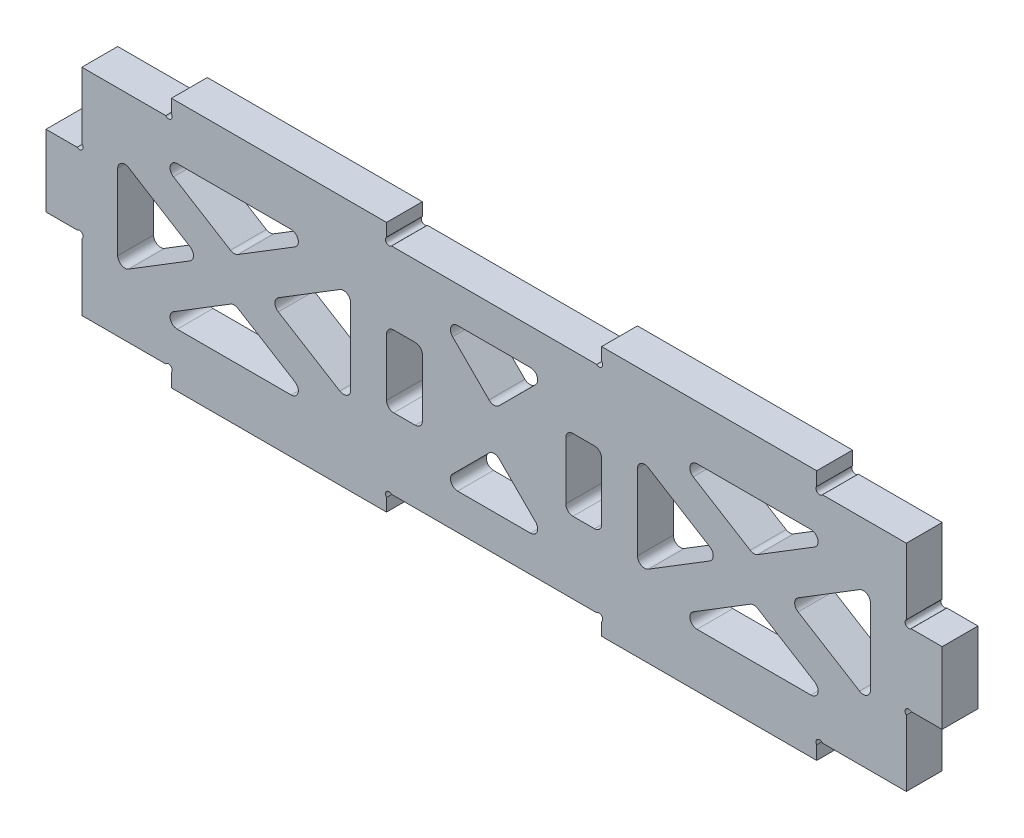
from build123d import *

# Parameters (mm, degrees)
SKETCH1_W           = 317.5
SKETCH1_H           = 76.2
BOSS_EXTRUDE1_DEPTH = 12.7
SKETCH2_W           = 76.2
SKETCH2_H           = 6.35
BOSS_EXTRUDE2_DEPTH = 12.7
SKETCH3_W           = 12.7
SKETCH3_H           = 25.4
CUT_EXTRUDE1_DEPTH  = 166.344050392
SKETCH7_R           = 1.27
CUT_EXTRUDE4_DEPTH  = 166.344050392
CUT_EXTRUDE6_DEPTH  = 166.344050392
FILLET1_R           = 2.54


with BuildPart() as part:
    # Sketch1 → Boss-Extrude1 (new body)
    with BuildSketch(Plane.XY):
        Rectangle(SKETCH1_W, SKETCH1_H)
    extrude(amount=BOSS_EXTRUDE1_DEPTH)

    # Sketch2 → Boss-Extrude2 (add)
    with BuildSketch(Plane.XY.offset(12.7)):
        with Locations((-76.2, -41.275)):
            Rectangle(SKETCH2_W, SKETCH2_H)
        with Locations((76.2, -41.275)):
            Rectangle(SKETCH2_W, SKETCH2_H)
        with Locations((76.2, 41.275)):
            Rectangle(SKETCH2_W, SKETCH2_H)
        with Locations((-76.2, 41.275)):
            Rectangle(SKETCH2_W, SKETCH2_H)
    extrude(amount=-BOSS_EXTRUDE2_DEPTH)

    # Sketch3 → Cut-Extrude1 (cut, through all)
    with BuildSketch(Plane.XY.offset(12.7)):
        with Locations((-152.4, -25.4)):
            Rectangle(SKETCH3_W, SKETCH3_H)
        with Locations((-152.4, 25.4)):
            Rectangle(SKETCH3_W, SKETCH3_H)
        with Locations((152.4, 25.4)):
            Rectangle(SKETCH3_W, SKETCH3_H)
        with Locations((152.4, -25.4)):
            Rectangle(SKETCH3_W, SKETCH3_H)
        with Locations((31.75, 0)):
            Rectangle(SKETCH3_W, SKETCH3_H)
        with Locations((-31.75, 0)):
            Rectangle(SKETCH3_W, SKETCH3_H)
    extrude(amount=-CUT_EXTRUDE1_DEPTH, mode=Mode.SUBTRACT)

    # Sketch7 → Cut-Extrude4 (cut, through all)
    with BuildSketch(Plane.XY.offset(12.7)):
        with Locations((-115.322216931, -38.853639533)):
            Circle(SKETCH7_R)
        with Locations((-37.219883345, -39.015584335)):
            Circle(SKETCH7_R)
        with Locations((37.219883345, -39.015584335)):
            Circle(SKETCH7_R)
        with Locations((115.322216931, -38.853639533)):
            Circle(SKETCH7_R)
        with Locations((115.322216931, 38.853639533)):
            Circle(SKETCH7_R)
        with Locations((37.219883345, 39.015584335)):
            Circle(SKETCH7_R)
        with Locations((-37.219883345, 39.015584335)):
            Circle(SKETCH7_R)
        with Locations((-115.322216931, 38.853639533)):
            Circle(SKETCH7_R)
        with Locations((-146.889550892, -13.652918832)):
            Circle(SKETCH7_R)
        with Locations((-146.889550892, 13.652918832)):
            Circle(SKETCH7_R)
        with Locations((146.889550892, -13.652918832)):
            Circle(SKETCH7_R)
        with Locations((146.889550892, 13.652918832)):
            Circle(SKETCH7_R)
    extrude(amount=-CUT_EXTRUDE4_DEPTH, mode=Mode.SUBTRACT)

    # Sketch4 → Cut-Extrude6 (cut, through all)
    with BuildSketch(Plane.XY.offset(12.7)):
        Polygon((-92.075, -7.45604179), (-121.233932092, -25.4), (-62.916067908, -25.4), align=None)
        Polygon((-133.35, 17.94395821), (-133.35, -17.94395821), (-104.191067908, 0), align=None)
        Polygon((-79.958932092, 0), (-50.8, -17.94395821), (-50.8, 17.94395821), align=None)
        Polygon((-62.916067908, 25.4), (-121.233932092, 25.4), (-92.075, 7.45604179), align=None)
        Polygon((19.05, 25.4), (-19.05, 25.4), (0, 6.35), align=None)
        Polygon((0, -6.35), (-19.05, -25.4), (19.05, -25.4), align=None)
    cut_extrude6 = extrude(amount=-CUT_EXTRUDE6_DEPTH, mode=Mode.SUBTRACT)

    # Mirror1: Cut-Extrude6 across plane
    add(cut_extrude6.mirror(Plane(origin=(0, 0, 0), x_dir=(0, 0, 1), z_dir=(1, 0, 0))), mode=Mode.SUBTRACT)

    # Fillet1
    fillet1_edges = [part.edges().sort_by_distance(p)[0] for p in [
        (-19.05, -25.4, 6.35),
        (-19.05, 25.4, 6.35),
        (-133.35, 17.94395821, 6.35),
        (-62.916067908, -25.4, 6.35),
        (-121.233932092, -25.4, 6.35),
        (-133.35, -17.94395821, 6.35),
        (-50.8, -17.94395821, 6.35),
        (-50.8, 17.94395821, 6.35),
        (-104.191067908, 0, 6.35),
        (-62.916067908, 25.4, 6.35),
        (-92.075, 7.45604179, 6.35),
        (-92.075, -7.45604179, 6.35),
        (-79.958932092, 0, 6.35),
        (-121.233932092, 25.4, 6.35),
        (62.916067908, 25.4, 6.35),
        (121.233932092, 25.4, 6.35),
        (133.35, 17.94395821, 6.35),
        (104.191067908, 0, 6.35),
        (62.916067908, -25.4, 6.35),
        (121.233932092, -25.4, 6.35),
        (92.075, -7.45604179, 6.35),
        (79.958932092, 0, 6.35),
        (50.8, 17.94395821, 6.35),
        (50.8, -17.94395821, 6.35),
        (92.075, 7.45604179, 6.35),
        (133.35, -17.94395821, 6.35),
        (19.05, -25.4, 6.35),
        (0, -6.35, 6.35),
        (19.05, 25.4, 6.35),
        (0, 6.35, 6.35),
        (38.1, -12.7, 6.35),
        (25.4, -12.7, 6.35),
        (38.1, 12.7, 6.35),
        (25.4, 12.7, 6.35),
        (-25.4, 12.7, 6.35),
        (-38.1, 12.7, 6.35),
        (-25.4, -12.7, 6.35),
        (-38.1, -12.7, 6.35),
    ]]
    fillet(fillet1_edges, radius=FILLET1_R)


solid = part.part
